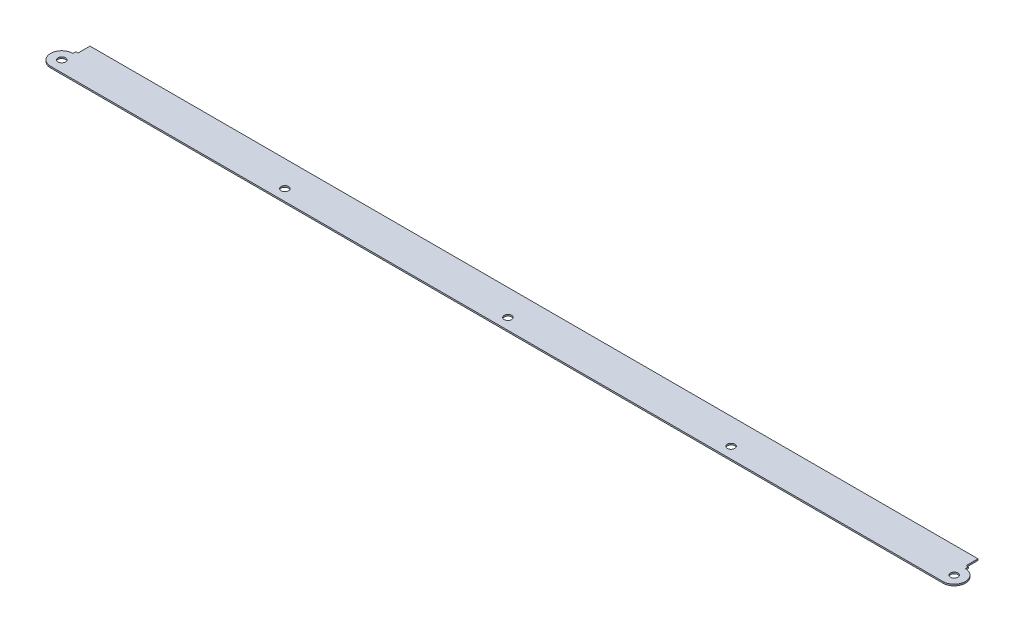
from build123d import *

# Parameters (mm, degrees)
SKETCH1_R           = 2.5
BOSS_EXTRUDE1_DEPTH = 1


with BuildPart() as part:
    # Sketch1 → Boss-Extrude1 (new body)
    with BuildSketch(Plane(origin=(0, 0, 0), x_dir=(1, 0, 0), z_dir=(0, 1, 0))):
        with BuildLine():
            Line((-300, -7.5), (300, -7.5))
            ThreePointArc((300, -7.5), (307.5, 0), (300, 7.5))
            Line((300, 7.5), (300, 9.5))
            Line((300, 9.5), (298.5, 9.5))
            Line((298.5, 9.5), (298.5, 17.5))
            Line((298.5, 17.5), (-298.5, 17.5))
            Line((-298.5, 17.5), (-298.5, 9.5))
            Line((-298.5, 9.5), (-300, 9.5))
            Line((-300, 9.5), (-300, 7.5))
            ThreePointArc((-300, 7.5), (-307.5, 0), (-300, -7.5))
        make_face()
        Circle(SKETCH1_R, mode=Mode.SUBTRACT)
        with Locations((150, 0)):
            Circle(SKETCH1_R, mode=Mode.SUBTRACT)
        with Locations((-150, 0)):
            Circle(SKETCH1_R, mode=Mode.SUBTRACT)
        with Locations((-300, 0)):
            Circle(SKETCH1_R, mode=Mode.SUBTRACT)
        with Locations((300, 0)):
            Circle(SKETCH1_R, mode=Mode.SUBTRACT)
    extrude(amount=BOSS_EXTRUDE1_DEPTH)


solid = part.part
